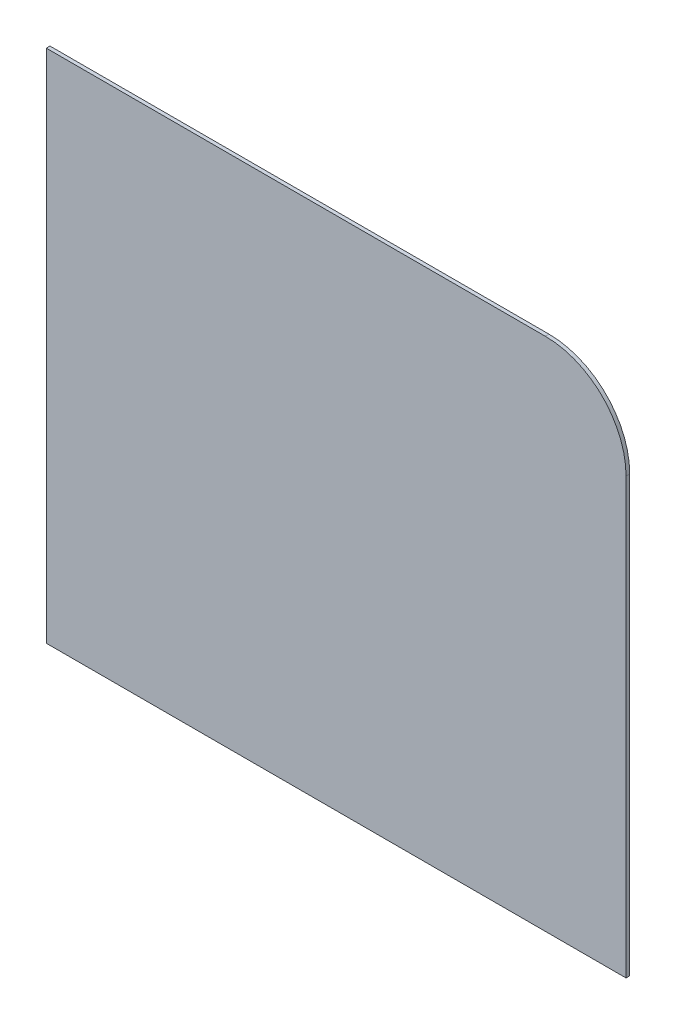
from build123d import *

# Parameters (mm, degrees)
BOSS_EXTRUDE1_START = 500
SKETCH1_W           = 502.630931949
SKETCH1_H           = 446.8
BOSS_EXTRUDE1_DEPTH = 3.175
FILLET1_R           = 70


with BuildPart() as part:
    # Sketch1 → Boss-Extrude1 (new body)
    with BuildSketch(Plane.XY.offset(BOSS_EXTRUDE1_START)):
        with Locations((13.684534025, 226.6)):
            Rectangle(SKETCH1_W, SKETCH1_H)
    extrude(amount=BOSS_EXTRUDE1_DEPTH)

    # Fillet1
    fillet1_edges = [part.edges().sort_by_distance(p)[0] for p in [
        (265, 450, 501.5875),
    ]]
    fillet(fillet1_edges, radius=FILLET1_R)


solid = part.part
